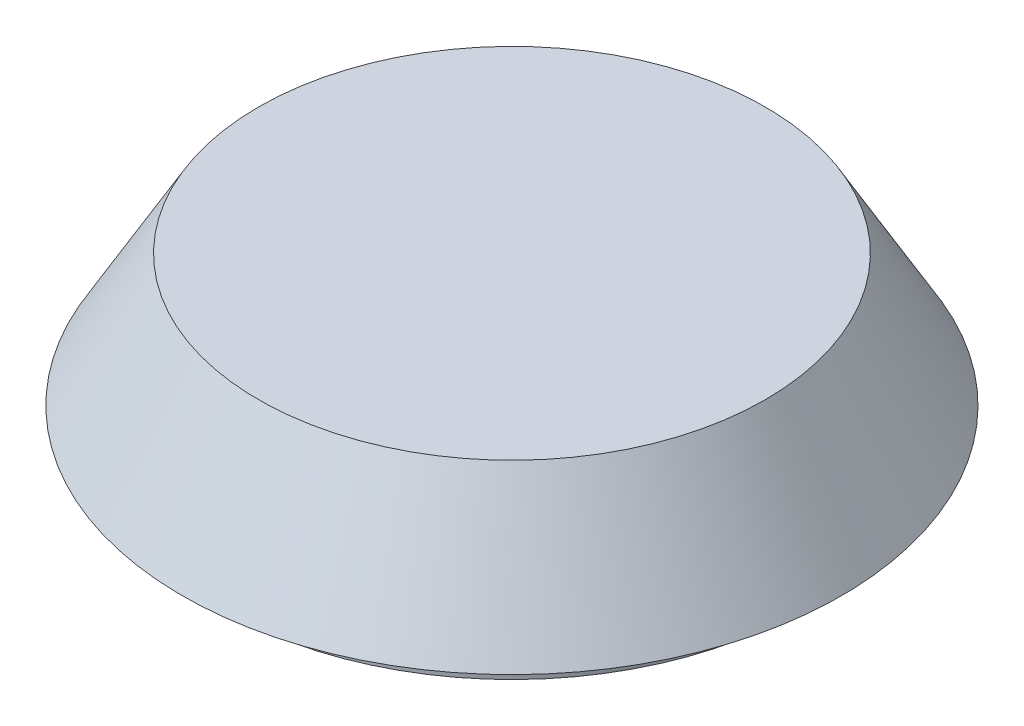
from build123d import *

# Parameters (mm, degrees)
SKETCH2_R           = 43.85
BOSS_EXTRUDE1_DEPTH = 5


with BuildPart() as part:
    # Sketch2 → Boss-Extrude1 (new body)
    with BuildSketch(Plane(origin=(0, 0, 0), x_dir=(1, 0, 0), z_dir=(0, 1, 0))):
        Circle(SKETCH2_R)
    extrude(amount=BOSS_EXTRUDE1_DEPTH)

    # Sketch4 → Revolve1 (revolve)
    with BuildSketch(Plane.XY):
        Polygon((0, 5), (50, 5), (38.452994616, 25), (0, 25), align=None)
    revolve(axis=Axis((0, 25, 0), (0, -1, 0)))


solid = part.part
